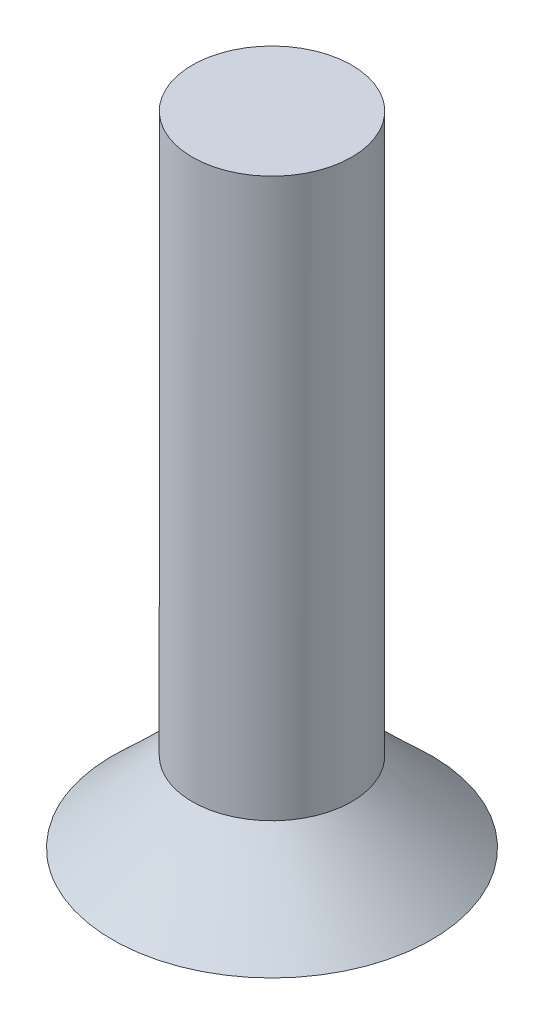
from build123d import *

# Parameters (mm, degrees)
SKETCH9_R           = 1.5
BOSS_EXTRUDE1_DEPTH = 10.5
CUT_EXTRUDE1_DEPTH  = 1


with BuildPart() as part:
    # Loft1: read off the stored shape, not the designer's step
    # Loft1: loft between two sections, ruled curve by curve
    loft1_from = [
        Edge.make_bspline([(2.279993266, 0, -1.949777092), (-1.619560918, 0, -6.509763623), (-6.179547449, 0, -2.61020944), (-2.279993266, 0, 1.949777092), (1.619560918, 0, 6.509763623), (6.179547449, 0, 2.61020944), (2.279993266, 0, -1.949777092)], [0, 0, 0, 0, 0.5, 0.5, 0.5, 1, 1, 1, 1], 3, [1, 0.333333333, 0.333333333, 1, 0.333333333, 0.333333333, 1]),
    ]
    loft1_to = [
        Edge.make_bspline([(0.694387174, 1.5, -1.32959635), (-1.964805526, 1.5, -2.718370697), (-3.353579873, 1.5, -0.059177997), (-0.694387174, 1.5, 1.32959635), (1.964805526, 1.5, 2.718370697), (3.353579873, 1.5, 0.059177997), (0.694387174, 1.5, -1.32959635)], [0, 0, 0, 0, 0.5, 0.5, 0.5, 1, 1, 1, 1], 3, [1, 0.333333333, 0.333333333, 1, 0.333333333, 0.333333333, 1]),
    ]
    loft1 = Solid(Shell([*[Face.make_surface_from_curves(loft1_from[k], loft1_to[k]) for k in range(1)], Face(Wire(loft1_from)), Face(Wire(loft1_to))]))
    add(loft1)

    # Sketch9 → Boss-Extrude1 (add)
    with BuildSketch(Plane(origin=(0, 1.5, 0), x_dir=(1, 0, 0), z_dir=(0, 1, 0))):
        with Locations(Location((0, 0, 0), (0, 0, 62.424))):
            Circle(SKETCH9_R)
    extrude(amount=BOSS_EXTRUDE1_DEPTH)

    # Sketch10 → Cut-Extrude1 (cut)
    with BuildSketch(Plane(origin=(0, 0, 0), x_dir=(-1, 0, 0), z_dir=(0, -1, 0))):
        Polygon((-1.443375673, 0), (-0.721687836, -1.25), (0.721687836, -1.25), (1.443375673, 0), (0.721687836, 1.25), (-0.721687836, 1.25), align=None)
    extrude(amount=-CUT_EXTRUDE1_DEPTH, mode=Mode.SUBTRACT)


solid = part.part
